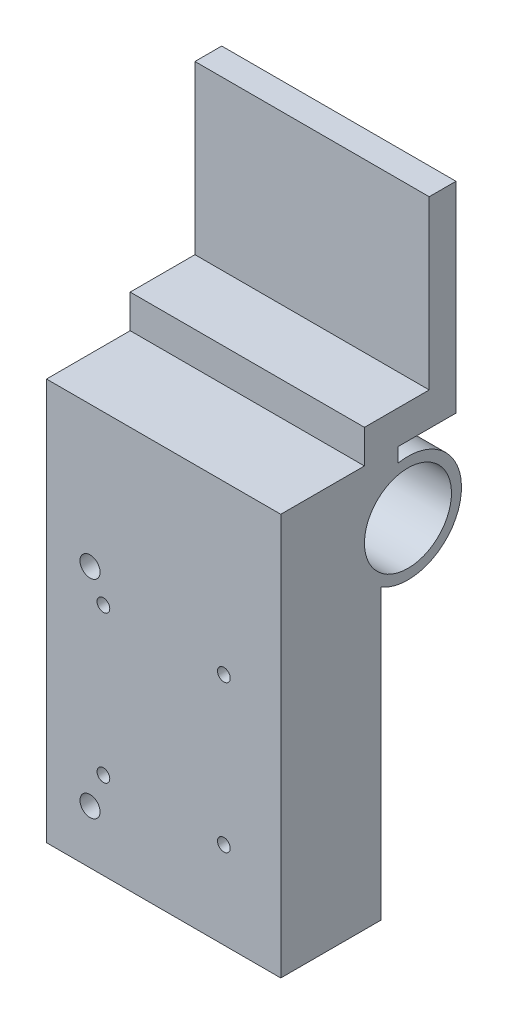
from build123d import *

# Parameters (mm, degrees)
SKETCH1_W                            = 35
SKETCH1_H                            = 60
BOSS_EXTRUDE1_DEPTH                  = 15
SKETCH2_R                            = 1.5
SKETCH2_R_2                          = 0.95
CUT_EXTRUDE1_DEPTH                   = 72.063352018
MIRROR1_OUTLINE_R                    = 0.95
MIRROR1_DEPTH                        = 15
SKETCH3_R                            = 8
BOSS_EXTRUDE2_DEPTH                  = 12
SKETCH4_R                            = 6.5
CUT_EXTRUDE2_DEPTH                   = 72.063352018
SKETCH5_W                            = 35
SKETCH5_H                            = 5
BOSS_EXTRUDE4_DEPTH                  = 5
BOSS_EXTRUDE4_DIRECTION_2_REACH      = 73.063
BOSS_EXTRUDE4_DIRECTION_2_END_RADIUS = 8
BOSS_EXTRUDE7_DEPTH                  = 35


# Read off the part's stored shape, not the designer's step: Mirror1
with BuildPart() as part:
    # Sketch1 → Boss-Extrude1 (new body)
    with BuildSketch(Plane.XY):
        with Locations((-17.5, 30)):
            Rectangle(SKETCH1_W, SKETCH1_H)
    extrude(amount=BOSS_EXTRUDE1_DEPTH)

    # Sketch2 → Cut-Extrude1 (cut, through all)
    with BuildSketch(Plane.XY.offset(15)):
        with Locations((-28.5, 8)):
            Circle(SKETCH2_R)
        with Locations((-26.5, 13)):
            Circle(SKETCH2_R_2)
        with Locations((-26.5, 35)):
            Circle(SKETCH2_R_2)
        with Locations((-28.5, 39)):
            Circle(SKETCH2_R)
    extrude(amount=-CUT_EXTRUDE1_DEPTH, mode=Mode.SUBTRACT)

    # Mirror1 outline → Mirror1 (cut)
    with BuildSketch(Plane.XY):
        with Locations((-8.5, 35)):
            Circle(MIRROR1_OUTLINE_R)
        with Locations((-8.5, 13)):
            Circle(MIRROR1_OUTLINE_R)
    extrude(amount=MIRROR1_DEPTH, mode=Mode.SUBTRACT)

    # Sketch3 → Boss-Extrude2 (add)
    with BuildSketch(Plane.ZY.offset(35)):
        with Locations((-4, 50)):
            Circle(SKETCH3_R)
    boss_extrude2 = extrude(amount=-BOSS_EXTRUDE2_DEPTH)

    # Sketch4 → Cut-Extrude2 (cut, through all)
    with BuildSketch(Plane.ZY.offset(35)):
        with Locations(Location((-4, 50, 0), (0, 0, 270))):
            Circle(SKETCH4_R)
    cut_extrude2 = extrude(amount=-CUT_EXTRUDE2_DEPTH, mode=Mode.SUBTRACT)

    # Mirror2: Boss-Extrude2, Cut-Extrude2 across plane
    add(boss_extrude2.mirror(Plane(origin=(-17.5, 0, 0), x_dir=(0, 0, 1), z_dir=(1, 0, 0))))
    add(cut_extrude2.mirror(Plane(origin=(-17.5, 0, 0), x_dir=(0, 0, 1), z_dir=(1, 0, 0))), mode=Mode.SUBTRACT)

    # Sketch5 → Boss-Extrude4 (add)
    with BuildSketch(Plane(origin=(0, 60, 0), x_dir=(1, 0, 0), z_dir=(0, 1, 0))):
        with Locations((-17.5, 0)):
            Rectangle(SKETCH5_W, SKETCH5_H)
    extrude(amount=BOSS_EXTRUDE4_DEPTH)

    # Boss-Extrude4 direction 2: up to this cylinder (the profile starts outside it)
    boss_extrude4_direction_2_end = Plane(origin=(-17.5, 50, -4), z_dir=(-1, 0, 0)) * Cylinder(BOSS_EXTRUDE4_DIRECTION_2_END_RADIUS, 163.126, mode=Mode.PRIVATE)
    # Sketch5 → Boss-Extrude4 direction 2 (add, up to the surface)
    with BuildSketch(Plane(origin=(0, 60, 0), x_dir=(1, 0, 0), z_dir=(0, 1, 0)), mode=Mode.PRIVATE) as boss_extrude4_direction_2_sk1:
        with Locations((-17.5, 0)):
            Rectangle(SKETCH5_W, SKETCH5_H)
    boss_extrude4_direction_2_tool1 = extrude(boss_extrude4_direction_2_sk1.sketch, amount=-BOSS_EXTRUDE4_DIRECTION_2_REACH, mode=Mode.PRIVATE) - boss_extrude4_direction_2_end
    add(boss_extrude4_direction_2_tool1.solids().sort_by_distance((-17.5, 60, 0))[0])

    # Sketch12 → Boss-Extrude7 (add, through all)
    with BuildSketch(Plane.ZY.offset(35)):
        Polygon((-2.5, 65), (-7.175, 65), (-7.175, 90), (-11.175, 90), (-11.175, 60), (-2.5, 60), align=None)
    extrude(amount=-BOSS_EXTRUDE7_DEPTH)


solid = part.part
